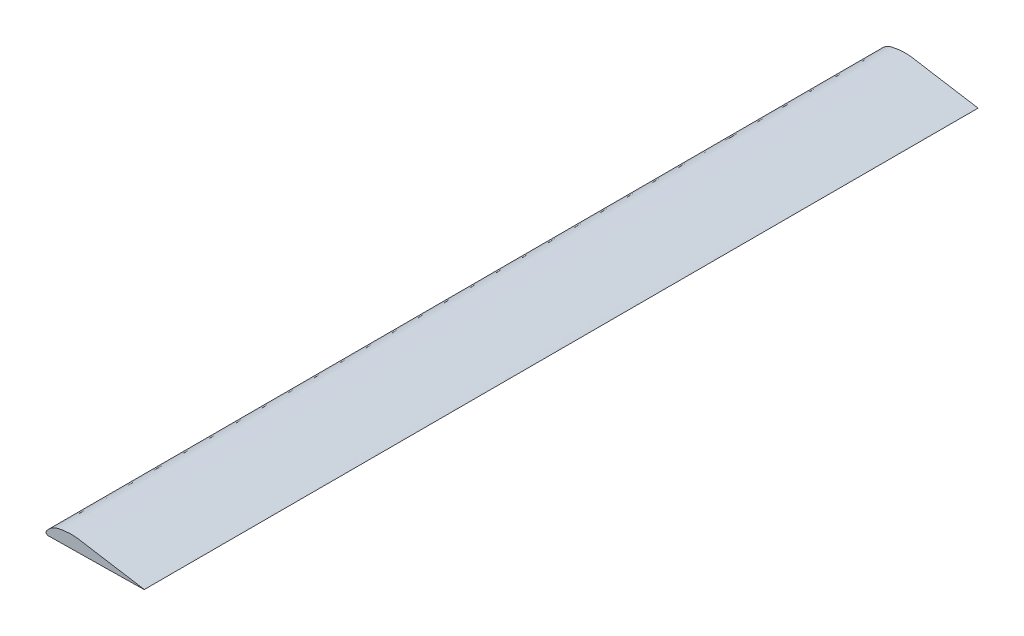
from build123d import *

# Parameters (mm, degrees)
BOSS_EXTRUDE1_DEPTH = 647.7


with BuildPart() as part:
    # Sketch1 → Boss-Extrude1 (new body)
    with BuildSketch(Plane.XY):
        with BuildLine():
            add(Edge.make_bspline(
                [(76.2, 0), (76.458583576, 0.180157567), (68.538144559, 1.173347983), (63.440040719, 2.154467745), (56.524538827, 3.271624756), (50.096082796, 4.353297253), (43.536851567, 5.44092215), (37.01366479, 6.540170394), (30.120458454, 7.64408335), (23.794576846, 8.868166839), (17.630857196, 8.938416345), (12.141450308, 8.304854483), (7.236430986, 7.315835475), (4.064200528, 5.376099052), (2.496868376, 4.040919544), (1.414706787, 2.937937429), (0.406658539, 1.896907645), (-0.434275958, 0.172470128), (0.819206142, -0.91445267), (3.34539384, -1.444033516), (7.363965762, -0.935694649), (12.646342403, -1.013380709), (17.945864405, -0.889048666), (23.24079995, -0.818846694), (28.536935845, -0.734142542), (33.832856916, -0.653317037), (39.128436264, -0.571433416), (44.425598035, -0.489949318), (49.716771836, -0.407925245), (55.030314391, -0.32761584), (60.260370564, -0.241033447), (65.802003395, -0.177828339), (70.180816081, -0.027387076), (75.993160033, -0.144107316), (76.2, 0)],
                knots=[0, 0, 0, 0, 0.042194185, 0.08438837, 0.126582556, 0.168776701, 0.210970886, 0.253165071, 0.295359257, 0.344459244, 0.376024875, 0.412649037, 0.45033922, 0.47015847, 0.482904042, 0.489771006, 0.499409248, 0.512015317, 0.51888228, 0.52748656, 0.56123752, 0.59498848, 0.62873944, 0.6624904, 0.69624136, 0.72999232, 0.76374328, 0.79749424, 0.8312452, 0.86499616, 0.89874712, 0.93249808, 0.96624904, 1, 1, 1, 1], degree=3))
        make_face()
    extrude(amount=BOSS_EXTRUDE1_DEPTH)


solid = part.part
